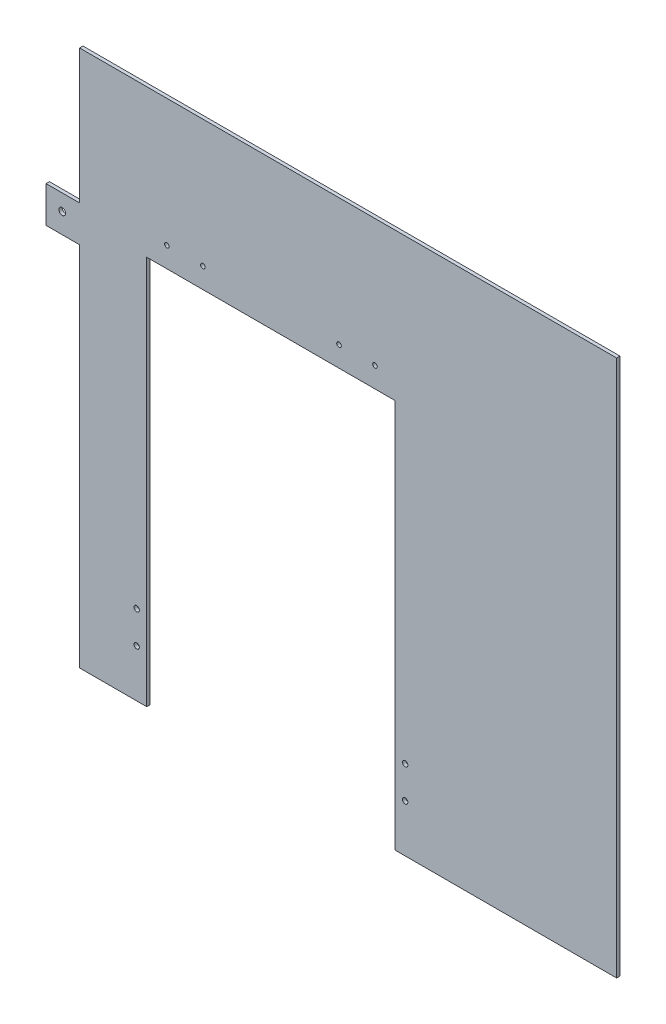
from build123d import *

# Parameters (mm, degrees)
SKETCH1_W           = 539.75
SKETCH1_H           = 508
BOSS_EXTRUDE1_DEPTH = 3.175
SKETCH2_R           = 2.54
SKETCH2_R_2         = 3.175
SKETCH2_W           = 234.95
SKETCH2_H           = 368.3
CUT_EXTRUDE1_DEPTH  = 44.45
SKETCH3_W           = 31.75
SKETCH3_H           = 127
SKETCH3_H_2         = 346.71
CUT_EXTRUDE2_DEPTH  = 742.218013222
SKETCH4_R           = 2.159
CUT_EXTRUDE3_DEPTH  = 742.218013222


with BuildPart() as part:
    # Sketch1 → Boss-Extrude1 (new body)
    with BuildSketch(Plane.XY):
        with Locations((269.875, 254)):
            Rectangle(SKETCH1_W, SKETCH1_H)
    extrude(amount=BOSS_EXTRUDE1_DEPTH)

    # Sketch2 → Cut-Extrude1 (cut)
    with BuildSketch(Plane(origin=(0, 0, 0), x_dir=(-1, 0, 0), z_dir=(0, 0, -1))):
        with Locations((-339.725, 45.085)):
            Circle(SKETCH2_R)
        with Locations((-85.725, 45.085)):
            Circle(SKETCH2_R)
        with Locations((-15.24, 365.76)):
            Circle(SKETCH2_R_2)
        with Locations((-339.725, 75.565)):
            Circle(SKETCH2_R)
        with Locations((-85.725, 75.565)):
            Circle(SKETCH2_R)
        with Locations((-212.725, 184.15)):
            Rectangle(SKETCH2_W, SKETCH2_H)
    extrude(amount=-CUT_EXTRUDE1_DEPTH, mode=Mode.SUBTRACT)

    # Sketch3 → Cut-Extrude2 (cut, through all)
    with BuildSketch(Plane(origin=(0, 0, 0), x_dir=(-1, 0, 0), z_dir=(0, 0, -1))):
        with Locations((-15.875, 444.5)):
            Rectangle(SKETCH3_W, SKETCH3_H)
        with Locations((-15.875, 173.355)):
            Rectangle(SKETCH3_W, SKETCH3_H_2)
    extrude(amount=-CUT_EXTRUDE2_DEPTH, mode=Mode.SUBTRACT)

    # Sketch4 → Cut-Extrude3 (cut, through all)
    with BuildSketch(Plane(origin=(0, 0, 0), x_dir=(-1, 0, 0), z_dir=(0, 0, -1))):
        with Locations((-311.1754, 387.604)):
            Circle(SKETCH4_R)
        with Locations((-277.1394, 387.604)):
            Circle(SKETCH4_R)
        with Locations((-148.3614, 387.604)):
            Circle(SKETCH4_R)
        with Locations((-114.3254, 387.604)):
            Circle(SKETCH4_R)
    extrude(amount=-CUT_EXTRUDE3_DEPTH, mode=Mode.SUBTRACT)


solid = part.part
